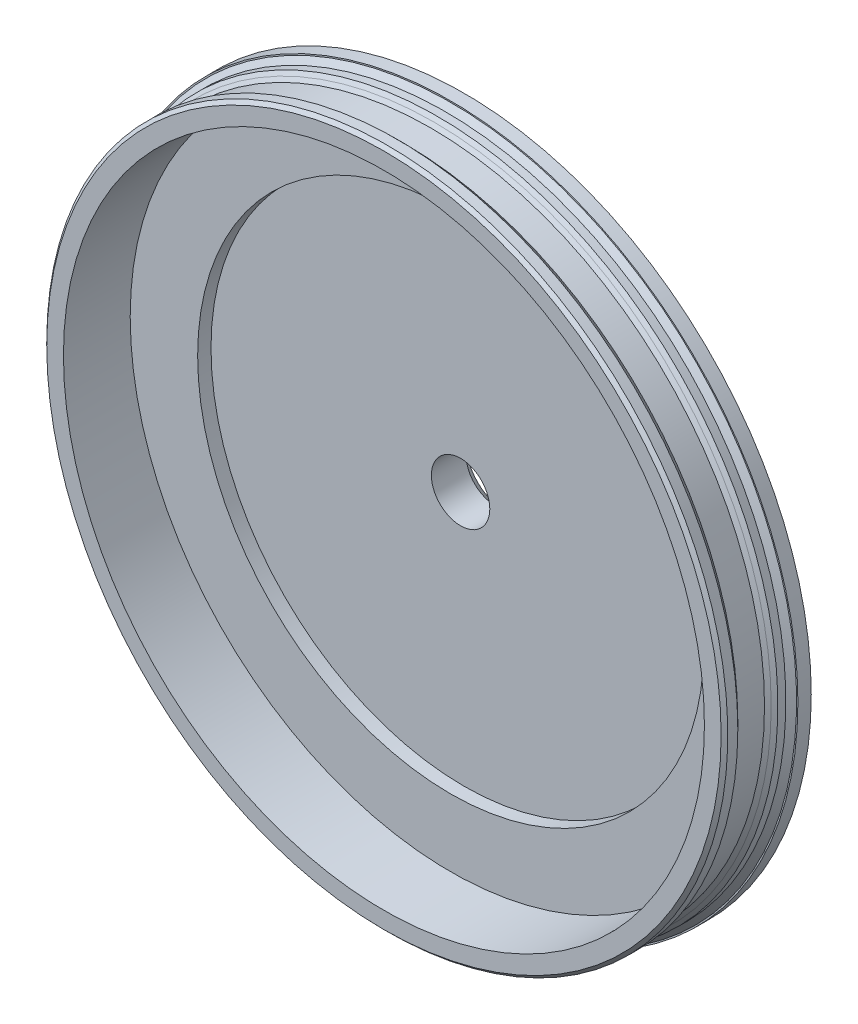
from build123d import *

# Parameters (mm, degrees)
CHAMFER1_SIZE       = 0.5
CHAMFER2_SIZE       = 0.8
SKETCH3_R           = 40.418258265
SKETCH3_R_2         = 4.375
BOSS_EXTRUDE1_DEPTH = 6.7
CHAMFER3_SIZE       = 1.5


with BuildPart() as part:
    # Sketch1 → Revolve1 (revolve)
    with BuildSketch(Plane(origin=(0, 0, 0), x_dir=(1, 0, 0), z_dir=(0, 1, 0)), mode=Mode.PRIVATE) as revolve1_sk:
        Polygon((37.9, 0), (37.9, -8.7), (48, -8.7), (48, -18.7), (51, -18.7), (51, -16.2), (50, -16.2), (50, -11.2), (51, -11.2), (51, -8.7), (52, -8.7), (52, -6.7), (39.9, -6.7), (39.9, 0), align=None)
    revolve(revolve1_sk.sketch.rotate(Axis((0, 0, -73.981367368), (0, 0, 1)), 180), axis=Axis((0, 0, -73.981367368), (0, 0, 1)))

    # Chamfer1
    chamfer1_edges = [part.edges().sort_by_distance(p)[0] for p in [
        (51, 0, 11.2),
        (50, 0, 11.2),
        (50, 0, 16.2),
        (51, 0, 16.2),
        (51, 0, 18.7),
        (39.9, 0, 0),
    ]]
    chamfer(chamfer1_edges, length=CHAMFER1_SIZE - 0.0001)  # a hair under: the kernel refuses the full size

    # Chamfer2
    chamfer2_edges = [part.edges().sort_by_distance(p)[0] for p in [
        (51, 0, 8.7),
    ]]
    chamfer(chamfer2_edges, length=CHAMFER2_SIZE)

    # Sketch3 → Boss-Extrude1 (add)
    with BuildSketch(Plane(origin=(0, 0, 6.7), x_dir=(-1, 0, 0), z_dir=(0, 0, -1))):
        with Locations(Location((0.518258265, 0, 0), (0, 0, 180))):
            Circle(SKETCH3_R)
        with Locations(Location((0.518258265, 0, 0), (0, 0, 180))):
            Circle(SKETCH3_R_2, mode=Mode.SUBTRACT)
    extrude(amount=BOSS_EXTRUDE1_DEPTH)

    # Chamfer3
    chamfer3_edges = [part.edges().sort_by_distance(p)[0] for p in [
        (-4.893258265, 0, 0),
    ]]
    chamfer(chamfer3_edges, length=CHAMFER3_SIZE)


solid = part.part
